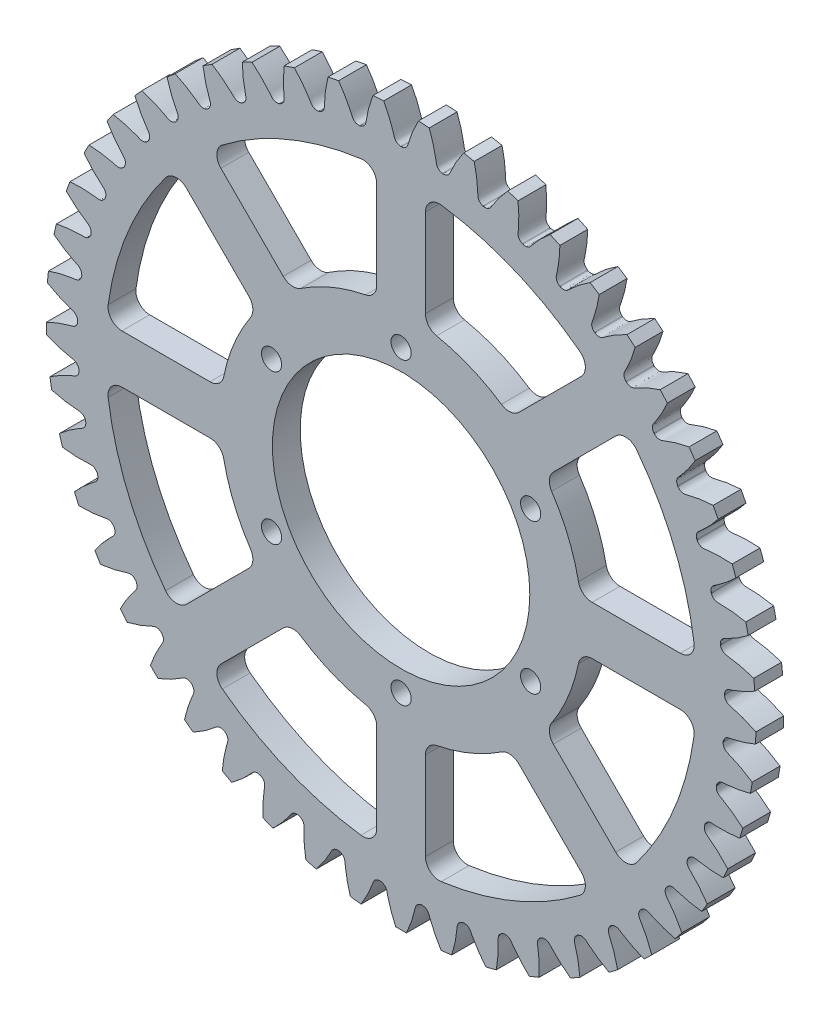
from build123d import *

# Parameters (mm, degrees)
SKETCH_1_R               = 51
EXTRUDE_1_DEPTH          = 4
CUT_EXTRUDE_1_DEPTH      = 73.235725233
PATTERN_CIRCULAR_1_COUNT = 49
SKETCH_4_R               = 1.45
SKETCH_4_R_2             = 18.5
CUT_EXTRUDE_2_DEPTH      = 73.23059453
CUT_EXTRUDE_3_DEPTH      = 73.23059453
FILLET_1_R               = 2


with BuildPart() as part:
    # 草图1 → 凸台-拉伸1 (new body)
    with BuildSketch(Plane.XY):
        Circle(SKETCH_1_R)
    extrude(amount=EXTRUDE_1_DEPTH)

    # 草图2 → 切除-拉伸1 (cut, through all)
    with BuildSketch(Plane.XY):
        with BuildLine():
            ThreePointArc((0.05007685, 46.499973036), (0, 46.5), (-0.05007685, 46.499973036))
            add(Edge.make_bspline(
                [(-0.05007685, 46.499973036), (-0.873079809, 46.603533778), (-0.976264529, 47.223177344), (-1.183849044, 47.898339352), (-1.26835599, 48.158775246), (-1.364405874, 48.434689773), (-1.472256142, 48.725954921), (-1.592672441, 49.032132482), (-1.726257742, 49.352849909), (-1.873648824, 49.687690191), (-2.035458157, 50.036224402), (-2.212290146, 50.398002598), (-2.404735762, 50.772556847), (-2.613373447, 51.159400757), (-2.838768212, 51.558030033), (-3.081471276, 51.967922751), (-3.342019545, 52.388539733), (-3.62093516, 52.819324905), (-3.918725036, 53.25970568), (-4.235880408, 53.709093342), (-4.57287639, 54.166883449), (-4.93017155, 54.632456246), (-5.308207486, 55.105177084), (-5.707408405, 55.584396856), (-6.128180771, 56.069452439), (-6.570912734, 56.559667152), (-7.199405798, 57.228192371), (-7.692379662, 57.721623252), (-8.031721685, 58.048307074)],
                knots=[0, 0, 0, 0, 0.111955699, 0.129916082, 0.149172078, 0.169723688, 0.19157091, 0.214713747, 0.239152196, 0.264886259, 0.291915936, 0.320241226, 0.349862129, 0.380778645, 0.412990775, 0.446498519, 0.481301875, 0.517400845, 0.554795429, 0.593485626, 0.633471436, 0.67475286, 0.717329897, 0.761202547, 0.806370811, 0.852834688, 0.900594179, 1, 1, 1, 1], degree=3))
            ThreePointArc((-8.031721685, 58.048307074), (0, 58.601318307), (8.031721685, 58.048307074))
            add(Edge.make_bspline(
                [(0.05007685, 46.499973036), (0.873079809, 46.603533778), (0.976264529, 47.223177344), (1.183849044, 47.898339352), (1.26835599, 48.158775246), (1.364405874, 48.434689773), (1.472256142, 48.725954921), (1.592672441, 49.032132482), (1.726257742, 49.352849909), (1.873648824, 49.687690191), (2.035458157, 50.036224402), (2.212290146, 50.398002598), (2.404735762, 50.772556847), (2.613373447, 51.159400757), (2.838768212, 51.558030033), (3.081471276, 51.967922751), (3.342019545, 52.388539733), (3.62093516, 52.819324905), (3.918725036, 53.25970568), (4.235880408, 53.709093342), (4.57287639, 54.166883449), (4.93017155, 54.632456246), (5.308207486, 55.105177084), (5.707408405, 55.584396856), (6.128180771, 56.069452439), (6.570912734, 56.559667152), (7.199405798, 57.228192371), (7.692379662, 57.721623252), (8.031721685, 58.048307074)],
                knots=[0, 0, 0, 0, 0.111955699, 0.129916082, 0.149172078, 0.169723688, 0.19157091, 0.214713747, 0.239152196, 0.264886259, 0.291915936, 0.320241226, 0.349862129, 0.380778645, 0.412990775, 0.446498519, 0.481301875, 0.517400845, 0.554795429, 0.593485626, 0.633471436, 0.67475286, 0.717329897, 0.761202547, 0.806370811, 0.852834688, 0.900594179, 1, 1, 1, 1], degree=3))
        make_face()
    cut_extrude_1 = extrude(amount=CUT_EXTRUDE_1_DEPTH, mode=Mode.SUBTRACT)

    # 阵列(圆周)1: 切除-拉伸1 ×49 about axis
    pattern_circular_1_axis = Axis((0, 0, -0.25), (0, 0, 1))
    for i in range(1, PATTERN_CIRCULAR_1_COUNT):
        add(cut_extrude_1.rotate(pattern_circular_1_axis, i * 360 / PATTERN_CIRCULAR_1_COUNT), mode=Mode.SUBTRACT)

    # 草图4 → 切除-拉伸2 (cut, through all)
    with BuildSketch(Plane.XY.offset(4)):
        with Locations((18.619546181, 10.75)):
            Circle(SKETCH_4_R)
        with Locations((0, 21.5)):
            Circle(SKETCH_4_R)
        with Locations((18.619546181, -10.75)):
            Circle(SKETCH_4_R)
        with Locations((0, -21.5)):
            Circle(SKETCH_4_R)
        with Locations((-18.619546181, -10.75)):
            Circle(SKETCH_4_R)
        with Locations((-18.619546181, 10.75)):
            Circle(SKETCH_4_R)
        Circle(SKETCH_4_R_2)
    extrude(amount=-CUT_EXTRUDE_2_DEPTH, mode=Mode.SUBTRACT)

    # 草图5 → 切除-拉伸3 (cut, through all)
    with BuildSketch(Plane.XY.offset(4)):
        with BuildLine():
            Line((-25.763346056, 3.5), (-42.355637169, 3.5))
            ThreePointArc((-42.355637169, 3.5), (-39.264880132, 16.264045876), (-32.424831998, 27.47508453))
            Line((-32.424831998, 27.47508453), (-20.692310436, 15.742562968))
            ThreePointArc((-20.692310436, 15.742562968), (-24.020867845, 9.949769241), (-25.763346056, 3.5))
        make_face()
        with BuildLine():
            Line((-3.5, 42.355637169), (-3.5, 25.763346056))
            ThreePointArc((-3.5, 25.763346056), (-9.949769241, 24.020867845), (-15.742562968, 20.692310436))
            Line((-15.742562968, 20.692310436), (-27.47508453, 32.424831998))
            ThreePointArc((-27.47508453, 32.424831998), (-16.264045876, 39.264880132), (-3.5, 42.355637169))
        make_face()
        with BuildLine():
            Line((27.47508453, 32.424831998), (15.742562968, 20.692310436))
            ThreePointArc((15.742562968, 20.692310436), (9.949769241, 24.020867845), (3.5, 25.763346056))
            Line((3.5, 25.763346056), (3.5, 42.355637169))
            ThreePointArc((3.5, 42.355637169), (16.264045876, 39.264880132), (27.47508453, 32.424831998))
        make_face()
        with BuildLine():
            Line((42.355637169, 3.5), (25.763346056, 3.5))
            ThreePointArc((25.763346056, 3.5), (24.020867845, 9.949769241), (20.692310436, 15.742562968))
            Line((20.692310436, 15.742562968), (32.424831998, 27.47508453))
            ThreePointArc((32.424831998, 27.47508453), (39.264880132, 16.264045876), (42.355637169, 3.5))
        make_face()
        with BuildLine():
            Line((32.424831998, -27.47508453), (20.692310436, -15.742562968))
            ThreePointArc((20.692310436, -15.742562968), (24.020867845, -9.949769241), (25.763346056, -3.5))
            Line((25.763346056, -3.5), (42.355637169, -3.5))
            ThreePointArc((42.355637169, -3.5), (39.264880132, -16.264045876), (32.424831998, -27.47508453))
        make_face()
        with BuildLine():
            Line((3.5, -42.355637169), (3.5, -25.763346056))
            ThreePointArc((3.5, -25.763346056), (9.949769241, -24.020867845), (15.742562968, -20.692310436))
            Line((15.742562968, -20.692310436), (27.47508453, -32.424831998))
            ThreePointArc((27.47508453, -32.424831998), (16.264045876, -39.264880132), (3.5, -42.355637169))
        make_face()
        with BuildLine():
            Line((-27.47508453, -32.424831998), (-15.742562968, -20.692310436))
            ThreePointArc((-15.742562968, -20.692310436), (-9.949769241, -24.020867845), (-3.5, -25.763346056))
            Line((-3.5, -25.763346056), (-3.5, -42.355637169))
            ThreePointArc((-3.5, -42.355637169), (-16.264045876, -39.264880132), (-27.47508453, -32.424831998))
        make_face()
        with BuildLine():
            Line((-42.355637169, -3.5), (-25.763346056, -3.5))
            ThreePointArc((-25.763346056, -3.5), (-24.020867845, -9.949769241), (-20.692310436, -15.742562968))
            Line((-20.692310436, -15.742562968), (-32.424831998, -27.47508453))
            ThreePointArc((-32.424831998, -27.47508453), (-39.264880132, -16.264045876), (-42.355637169, -3.5))
        make_face()
    extrude(amount=-CUT_EXTRUDE_3_DEPTH, mode=Mode.SUBTRACT)

    # 圆角1
    fillet_1_edges = [part.edges().sort_by_distance(p)[0] for p in [
        (-42.355637169, 3.5, 2),
        (-32.424831998, 27.47508453, 2),
        (-20.692310436, 15.742562968, 2),
        (-25.763346056, 3.5, 2),
        (27.47508453, -32.424831998, 2),
        (3.5, -42.355637169, 2),
        (3.5, -25.763346056, 2),
        (15.742562968, -20.692310436, 2),
        (-3.5, -42.355637169, 2),
        (-27.47508453, -32.424831998, 2),
        (-15.742562968, -20.692310436, 2),
        (-3.5, -25.763346056, 2),
        (-32.424831998, -27.47508453, 2),
        (-42.355637169, -3.5, 2),
        (-25.763346056, -3.5, 2),
        (-20.692310436, -15.742562968, 2),
        (-3.5, 25.763346056, 2),
        (-15.742562968, 20.692310436, 2),
        (3.5, 42.355637169, 2),
        (27.47508453, 32.424831998, 2),
        (15.742562968, 20.692310436, 2),
        (3.5, 25.763346056, 2),
        (32.424831998, 27.47508453, 2),
        (42.355637169, 3.5, 2),
        (25.763346056, 3.5, 2),
        (20.692310436, 15.742562968, 2),
        (42.355637169, -3.5, 2),
        (32.424831998, -27.47508453, 2),
        (20.692310436, -15.742562968, 2),
        (25.763346056, -3.5, 2),
        (-3.5, 42.355637169, 2),
        (-27.47508453, 32.424831998, 2),
    ]]
    fillet(fillet_1_edges, radius=FILLET_1_R)


solid = part.part
